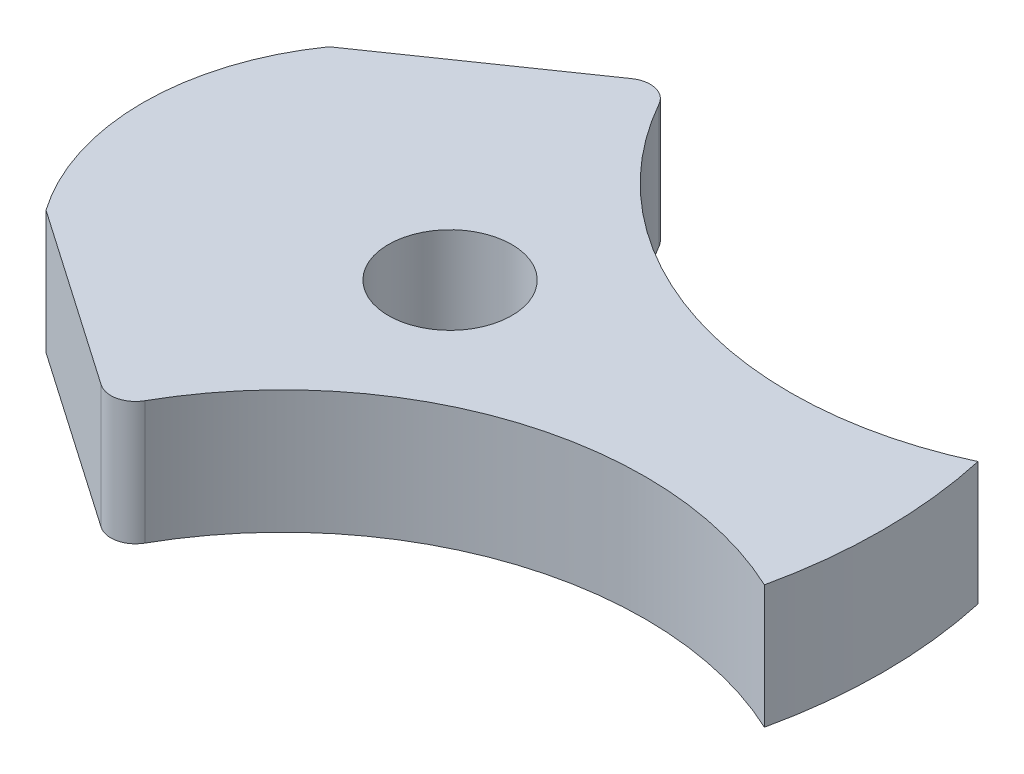
from build123d import *

# Parameters (mm, degrees)
BOSS_EXTRUDE1_DEPTH = 12.7
FILLET3_R           = 2.54
FILLET4_R           = 2.54
SKETCH3_R           = 6.35
CUT_EXTRUDE2_DEPTH  = 60.269511358


with BuildPart() as part:
    # Sketch1 → Boss-Extrude1 (new body)
    with BuildSketch(Plane(origin=(0, 0, 0), x_dir=(1, 0, 0), z_dir=(0, 1, 0))):
        with BuildLine():
            Line((-20.806461925, 14.568841483), (0, 28.959440013))
            ThreePointArc((0, 28.959440013), (21.077388652, 9.705652005), (49.595837162, 10.995132388))
            ThreePointArc((49.595837162, 10.995132388), (50.8, 0), (49.595837162, -10.995132388))
            ThreePointArc((49.595837162, -10.995132388), (21.077388652, -9.705652005), (0, -28.959440013))
            Line((0, -28.959440013), (-20.806461925, -14.568841483))
            ThreePointArc((-20.806461925, -14.568841483), (-25.4, 0), (-20.806461925, 14.568841483))
        make_face()
    extrude(amount=BOSS_EXTRUDE1_DEPTH)

    # Fillet3
    fillet3_edges = [part.edges().sort_by_distance(p)[0] for p in [
        (0, 6.35, -28.959440013),
    ]]
    fillet(fillet3_edges, radius=FILLET3_R)

    # Fillet4
    fillet4_edges = [part.edges().sort_by_distance(p)[0] for p in [
        (0, 6.35, 28.959440013),
    ]]
    fillet(fillet4_edges, radius=FILLET4_R)

    # Sketch3 → Cut-Extrude2 (cut, through all)
    with BuildSketch(Plane.XZ):
        with Locations((6.23189, 0)):
            Circle(SKETCH3_R)
    extrude(amount=-CUT_EXTRUDE2_DEPTH, mode=Mode.SUBTRACT)


solid = part.part
